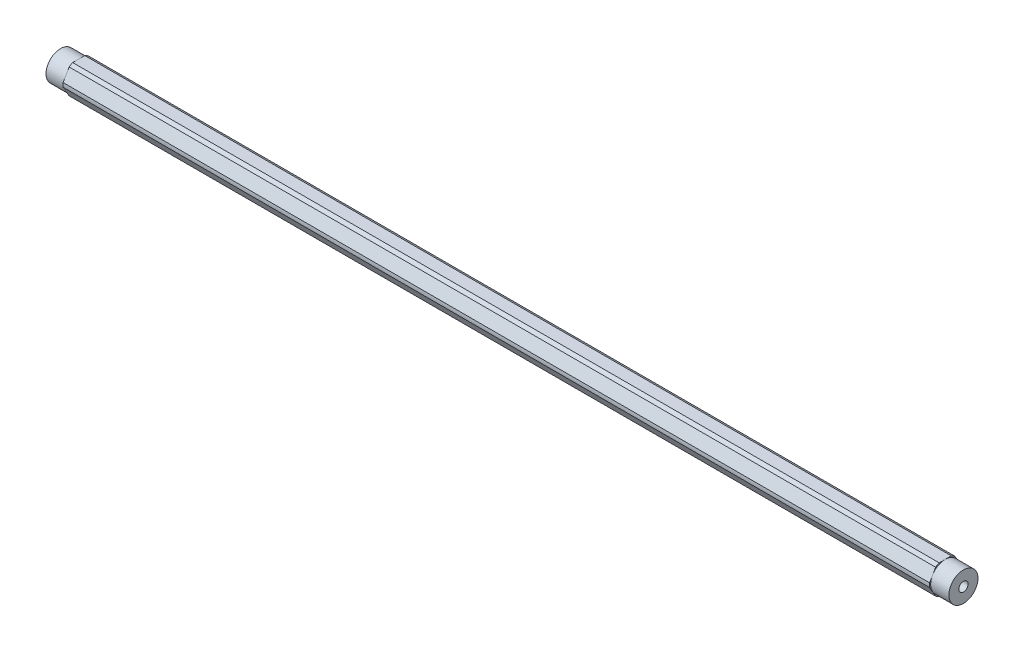
from build123d import *

# Parameters (mm, degrees)
SKETCH1_R               = 2.0193
BOSS_EXTRUDE1_DEPTH     = 196.85
SKETCH2_R               = 8.89
SKETCH2_R_2             = 6.35
CUT_EXTRUDE_THIN1_DEPTH = 7.9375


with BuildPart() as part:
    # Sketch1 → Boss-Extrude1 (new, symmetric)
    with BuildSketch(Plane(origin=(0, 0, 0), x_dir=(0, 0, -1), z_dir=(1, 0, 0))):
        with BuildLine():
            ThreePointArc((4.181770846, 5.456960429), (3.437499983, 5.953924622), (2.634980936, 6.35))
            Line((2.634980936, 6.35), (-2.634980936, 6.35))
            ThreePointArc((-2.634980936, 6.35), (-3.437499983, 5.953924622), (-4.181770846, 5.456960429))
            Line((-4.181770846, 5.456960429), (-6.816751782, 0.893039571))
            ThreePointArc((-6.816751782, 0.893039571), (-6.874999966, 0), (-6.816751782, -0.893039571))
            Line((-6.816751782, -0.893039571), (-4.181770846, -5.456960429))
            ThreePointArc((-4.181770846, -5.456960429), (-3.437499983, -5.953924622), (-2.634980936, -6.35))
            Line((-2.634980936, -6.35), (2.634980936, -6.35))
            ThreePointArc((2.634980936, -6.35), (3.437499983, -5.953924622), (4.181770846, -5.456960429))
            Line((4.181770846, -5.456960429), (6.816751782, -0.893039571))
            ThreePointArc((6.816751782, -0.893039571), (6.860422465, -0.447468582), (6.874999966, 0))
            ThreePointArc((6.874999966, 0), (6.860422465, 0.447468582), (6.816751782, 0.893039571))
            Line((6.816751782, 0.893039571), (4.181770846, 5.456960429))
        make_face()
        Circle(SKETCH1_R, mode=Mode.SUBTRACT)
    extrude(amount=BOSS_EXTRUDE1_DEPTH, both=True)

    # Sketch2 → Cut-Extrude-Thin1 (cut)
    with BuildSketch(Plane(origin=(196.85, 0, 0), x_dir=(0, 0, -1), z_dir=(1, 0, 0))):
        Circle(SKETCH2_R)
        Circle(SKETCH2_R_2, mode=Mode.SUBTRACT)
    cut_extrude_thin1 = extrude(amount=-CUT_EXTRUDE_THIN1_DEPTH, mode=Mode.SUBTRACT)

    # Mirror1: Cut-Extrude-Thin1 across plane
    add(cut_extrude_thin1.mirror(Plane(origin=(0, 0, 0), x_dir=(0, 0, 1), z_dir=(1, 0, 0))), mode=Mode.SUBTRACT)


solid = part.part
